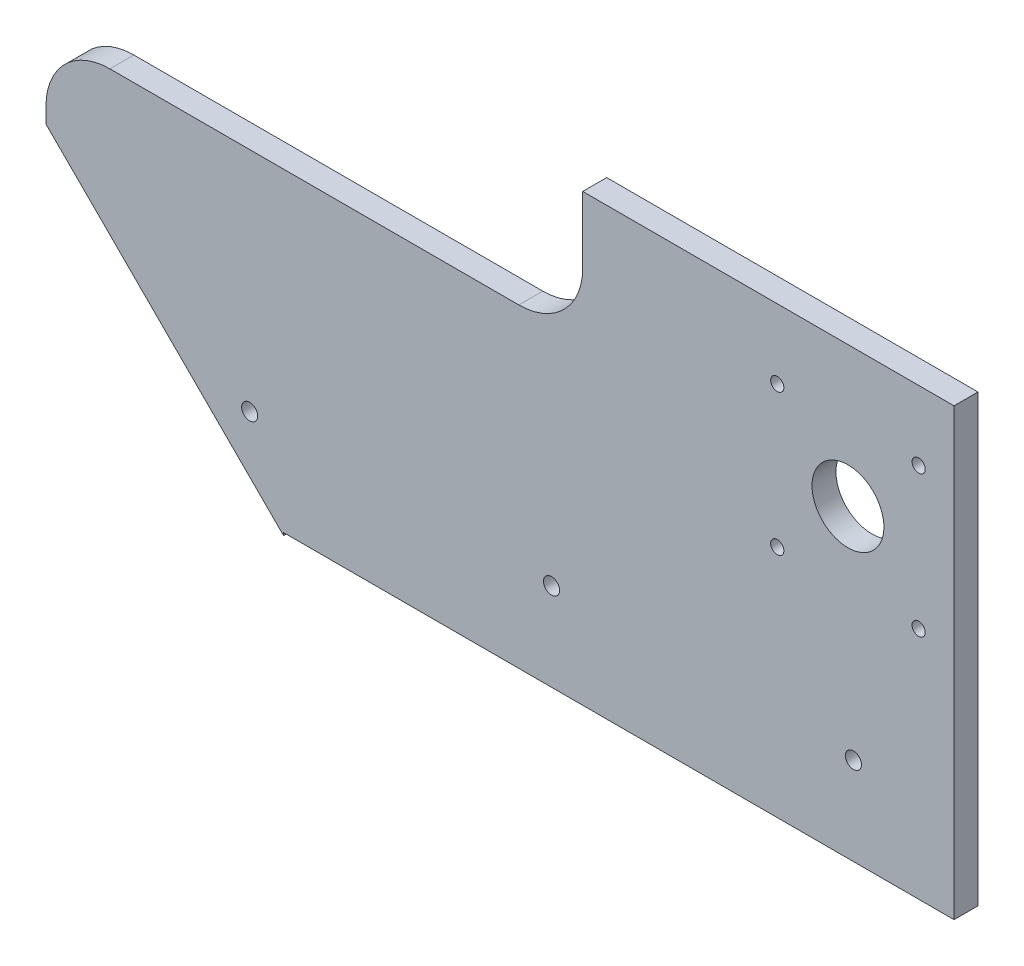
from build123d import *

# Parameters (mm, degrees)
SKETCH1_R                    = 14.2875
BOSS_EXTRUDE1_DEPTH          = 9.525
SKETCH2_W                    = 285.57287806
SKETCH2_H                    = 77.089
CUT_EXTRUDE1_DEPTH           = 267.58430025
SKETCH4_W                    = 213.36
SKETCH4_H                    = 65.465352004
CUT_EXTRUDE2_DEPTH           = 267.58430025
FILLET2_R                    = 25.4
SKETCH16_W                   = 9.525
SKETCH16_H                   = 0.985363282
CUT_EXTRUDE3_DEPTH           = 390.572219806
SKETCH17_W                   = 147.610011278
SKETCH17_H                   = 12.7
CUT_EXTRUDE4_DEPTH           = 267.045158533
TAP_DRILL_FOR_M6X0_75_TAP1_D = 5.25
F_6_4_6_4_DIAMETER_HOLE1_D   = 6.4


with BuildPart() as part:
    # Sketch1 → Boss-Extrude1 (new body)
    with BuildSketch(Plane.XY):
        Polygon((-138.259383474, 48.991487021), (32.210627804, -121.478524257), (222.710627804, -121.478524257), (222.710627804, 146.206839025), (-138.259383474, 146.206839025), align=None)
        with Locations((180.538014078, 76.831975743)):
            Circle(SKETCH1_R, mode=Mode.SUBTRACT)
    extrude(amount=BOSS_EXTRUDE1_DEPTH)

    # Sketch2 → Cut-Extrude1 (cut, through all)
    with BuildSketch(Plane.XY.offset(9.525)):
        with Locations((98.974188774, -82.934024257)):
            Rectangle(SKETCH2_W, SKETCH2_H)
    extrude(amount=-CUT_EXTRUDE1_DEPTH, mode=Mode.SUBTRACT)

    # Sketch4 → Cut-Extrude2 (cut, through all)
    with BuildSketch(Plane.XY.offset(9.525)):
        with Locations((-31.579383474, 113.474163023)):
            Rectangle(SKETCH4_W, SKETCH4_H)
    extrude(amount=-CUT_EXTRUDE2_DEPTH, mode=Mode.SUBTRACT)

    # Fillet2
    fillet2_edges = [part.edges().sort_by_distance(p)[0] for p in [
        (-138.259383474, 80.741487021, 4.7625),
        (75.100616526, 80.741487021, 4.7625),
    ]]
    fillet(fillet2_edges, radius=FILLET2_R)

    # Sketch16 → Cut-Extrude3 (cut, through all)
    with BuildSketch(Plane(origin=(222.710627804, 0, 0), x_dir=(0, 0, -1), z_dir=(1, 0, 0))):
        with Locations((-4.7625, 145.714157384)):
            Rectangle(SKETCH16_W, SKETCH16_H)
    extrude(amount=-CUT_EXTRUDE3_DEPTH, mode=Mode.SUBTRACT)

    # Sketch17 → Cut-Extrude4 (cut, through all)
    with BuildSketch(Plane(origin=(0, 0, 0), x_dir=(-1, 0, 0), z_dir=(0, 0, -1))):
        with Locations((-148.905622165, 138.871475743)):
            Rectangle(SKETCH17_W, SKETCH17_H)
    extrude(amount=-CUT_EXTRUDE4_DEPTH, mode=Mode.SUBTRACT)

    # Tap Drill for M6x0.75 Tap1 (through all)
    with Locations(Plane.XY.offset(9.525)):
        with Locations((208.638014078, 104.931975743), (152.438014078, 104.931975743), (152.438014078, 48.731975743), (208.638014078, 48.731975743)):
            Hole(TAP_DRILL_FOR_M6X0_75_TAP1_D / 2)

    # Ø6.4 (6.4) Diameter Hole1 (through all)
    with Locations(Plane.XY.offset(9.525)):
        with Locations((-57.289372206, -9.464524257), (62.710627794, -9.464524257), (182.710627794, -9.464524257)):
            Hole(F_6_4_6_4_DIAMETER_HOLE1_D / 2)


solid = part.part
